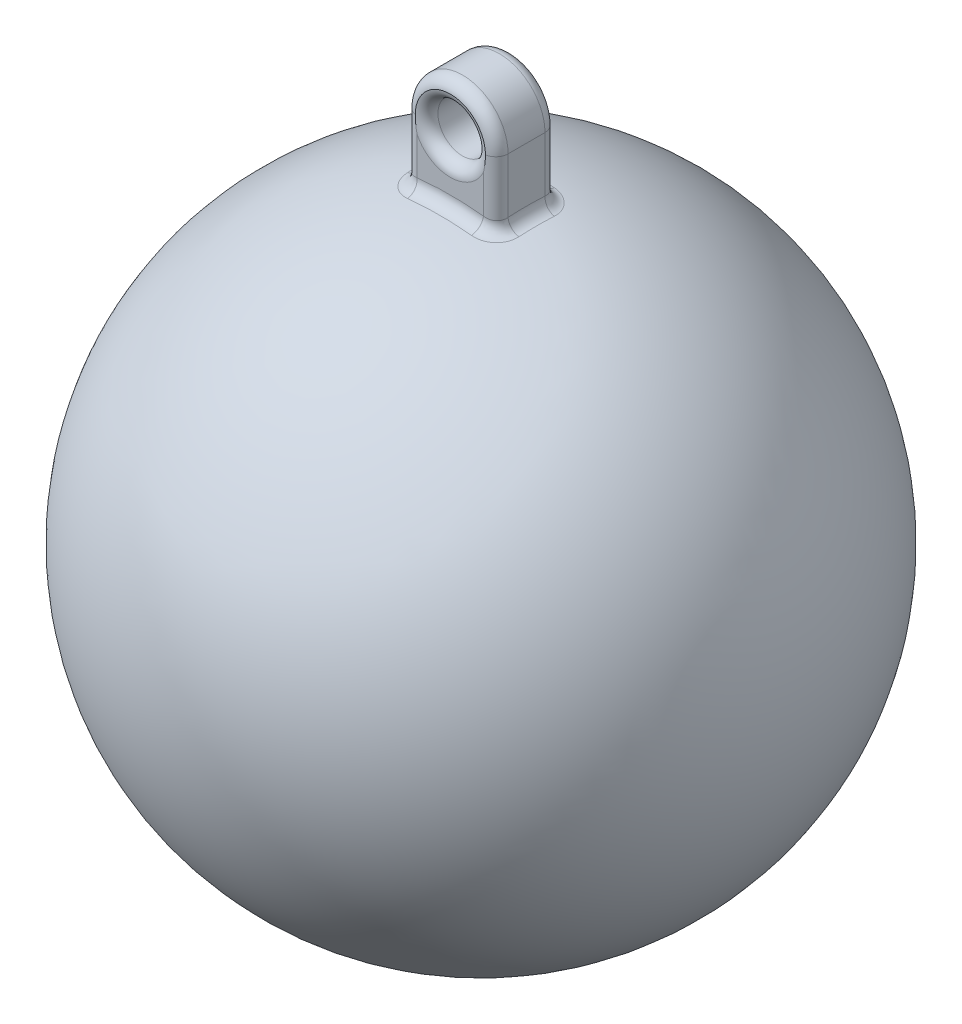
from build123d import *

# Parameters (mm, degrees)
SKETCH2_R           = 2
BOSS_EXTRUDE1_DEPTH = 2.5
FILLET1_R           = 1


with BuildPart() as part:
    # Sketch1 → Revolve1 (revolve)
    with BuildSketch(Plane(origin=(0, 0, 0), x_dir=(1, 0, 0), z_dir=(0, 1, 0))):
        with BuildLine():
            Line((25, 0), (-25, 0))
            ThreePointArc((-25, 0), (0, -25), (25, 0))
        make_face()
    revolve(axis=Axis((25, 0, 0), (-1, 0, 0)))

    # Sketch2 → Boss-Extrude1 (add, symmetric)
    with BuildSketch(Plane.XY):
        with BuildLine():
            Line((-3.7, 30), (-3.7, 20))
            Line((-3.7, 20), (3.7, 20))
            Line((3.7, 20), (3.7, 30))
            ThreePointArc((3.7, 30), (0, 33.7), (-3.7, 30))
        make_face()
        with Locations((0, 30)):
            Circle(SKETCH2_R, mode=Mode.SUBTRACT)
    extrude(amount=BOSS_EXTRUDE1_DEPTH, both=True)

    # Fillet1
    fillet1_edges = [part.edges().sort_by_distance(p)[0] for p in [
        (0, 33.7, -2.5),
        (3.7, 27.298983698, -2.5),
        (-3.7, 27.298983698, -2.5),
    ]]
    fillet(fillet1_edges, radius=FILLET1_R)
    fillet1_2_edges = [part.edges().sort_by_distance(p)[0] for p in [
        (3.7, 27.298983698, 2.5),
        (0, 33.7, 2.5),
        (-3.7, 27.298983698, 2.5),
    ]]
    fillet(fillet1_2_edges, radius=FILLET1_R)
    fillet1_3_edges = [part.edges().sort_by_distance(p)[0] for p in [
        (0, 24.874685928, -2.5),
    ]]
    fillet(fillet1_3_edges, radius=FILLET1_R)
    # the kernel refuses this fillet: 1 mm, written as the material it takes off along each edge
    with BuildSketch(Plane(origin=(0, 30, -2.5), x_dir=(1, 0, 0), z_dir=(0, -1, 0))) as fillet1_4_piece_1:
        with BuildLine():
            CenterArc((2 + FILLET1_R, FILLET1_R), FILLET1_R, 180, 90)
            Line((2, FILLET1_R), (2 - FILLET1_R * 0.02, FILLET1_R))
            Line((2 - FILLET1_R * 0.02, FILLET1_R), (2 - FILLET1_R * 0.02, -FILLET1_R * 0.02))
            Line((2 - FILLET1_R * 0.02, -FILLET1_R * 0.02), (2 + FILLET1_R, -FILLET1_R * 0.02))
            Line((2 + FILLET1_R, -FILLET1_R * 0.02), (2 + FILLET1_R, 0))
        make_face()
    revolve(axis=Axis((0, 30, -2.5), (0, 0, 1)), mode=Mode.SUBTRACT)
    # the kernel refuses this fillet: 1 mm, written as the material it takes off along each edge
    with BuildSketch(Plane(origin=(0, 30, 2.5), x_dir=(1, 0, 0), z_dir=(0, -1, 0))) as fillet1_5_piece_1:
        with BuildLine():
            CenterArc((2 + FILLET1_R, -FILLET1_R), FILLET1_R, 90, 90)
            Line((2, -FILLET1_R), (2 - FILLET1_R * 0.02, -FILLET1_R))
            Line((2 - FILLET1_R * 0.02, -FILLET1_R), (2 - FILLET1_R * 0.02, FILLET1_R * 0.02))
            Line((2 - FILLET1_R * 0.02, FILLET1_R * 0.02), (2 + FILLET1_R, FILLET1_R * 0.02))
            Line((2 + FILLET1_R, FILLET1_R * 0.02), (2 + FILLET1_R, 0))
        make_face()
    revolve(axis=Axis((0, 30, 2.5), (0, 0, 1)), mode=Mode.SUBTRACT)


solid = part.part
